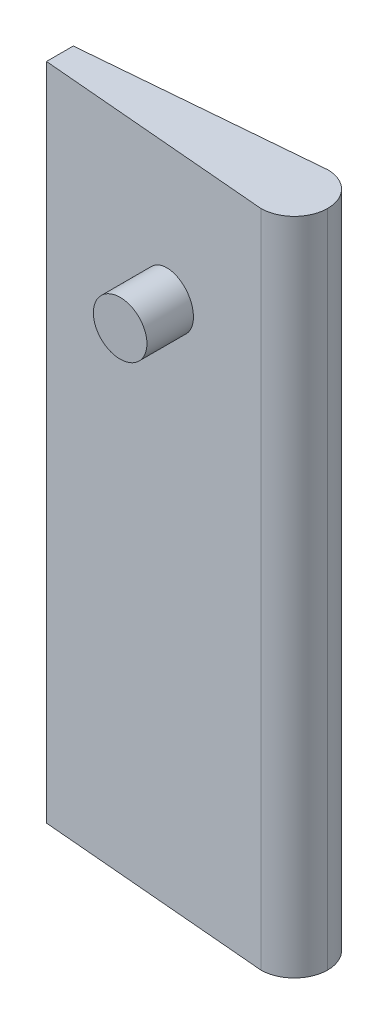
from build123d import *

# Parameters (mm, degrees)
SKETCH1_W           = 20
SKETCH1_H           = 49.25
BOSS_EXTRUDE1_DEPTH = 2.5
FILLET3_R           = 2.5
CUT_EXTRUDE1_DEPTH  = 51.317119353
SKETCH14_R          = 2
BOSS_EXTRUDE2_DEPTH = 5.5


with BuildPart() as part:
    # Sketch1 → Boss-Extrude1 (new, symmetric)
    with BuildSketch(Plane.XY):
        with Locations((0, 24.625)):
            Rectangle(SKETCH1_W, SKETCH1_H)
    extrude(amount=BOSS_EXTRUDE1_DEPTH, both=True)

    # Fillet3
    fillet3_edges = [part.edges().sort_by_distance(p)[0] for p in [
        (10, 24.625, 2.5),
        (10, 24.625, -2.5),
    ]]
    fillet(fillet3_edges, radius=FILLET3_R - 0.0001)  # a hair under: the kernel refuses the full size

    # Sketch11 → Cut-Extrude1 (cut, through all)
    with BuildSketch(Plane(origin=(0, 49.25, 0), x_dir=(1, 0, 0), z_dir=(0, 1, 0))):
        Polygon((-10, 1), (7.5, 2.5), (-10, 2.5), align=None)
        Polygon((7.5, -2.5), (-10, -1), (-10, -2.5), align=None)
    extrude(amount=-CUT_EXTRUDE1_DEPTH, mode=Mode.SUBTRACT)

    # Sketch14 → Boss-Extrude2 (add, symmetric)
    with BuildSketch(Plane.XY):
        with Locations((0, 39.25)):
            Circle(SKETCH14_R)
    extrude(amount=BOSS_EXTRUDE2_DEPTH, both=True)


solid = part.part
